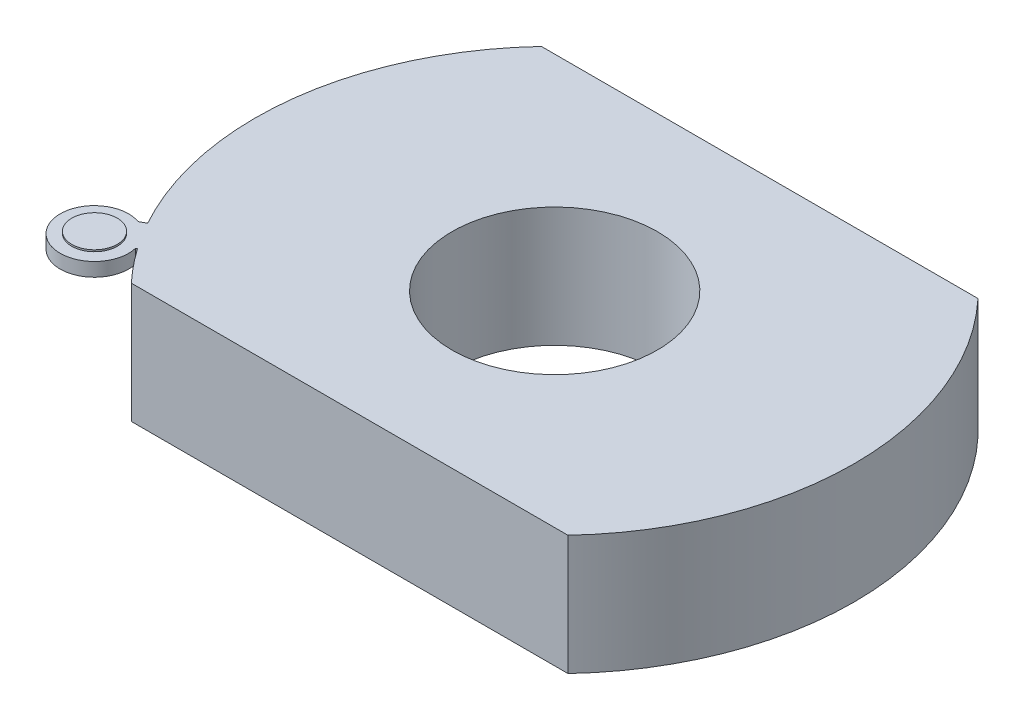
from build123d import *

# Parameters (mm, degrees)
SKETCH1_R                = 1750
BOSS_EXTRUDE1_DEPTH      = 700
CUT_EXTRUDE10_DEPTH      = 2572.964229922
CUT_EXTRUDE10_DEPTH_BACK = 2572.964229922
SKETCH9_W                = 5273.235769222
SKETCH9_H                = 4165.824449254
SKETCH9_W_2              = 4212.623718326
SKETCH9_H_2              = 2396.11984
CUT_EXTRUDE3_DEPTH       = 2234.348958831
CUT_EXTRUDE3_DEPTH_BACK  = 2234.348958831
SKETCH3_R                = 600
SHELL1_T                 = -1.5
BOSS_EXTRUDE2_START      = -80
BOSS_EXTRUDE2_DEPTH      = 80
SKETCH14_R               = 132.8125
BOSS_EXTRUDE5_DEPTH      = 10
SKETCH18_W               = 200
SKETCH18_H               = 200
SKETCH18_R               = 27.5
BOSS_EXTRUDE6_DEPTH      = 50


with BuildPart() as part:
    # Sketch1 → Boss-Extrude1 (new body)
    with BuildSketch(Plane(origin=(0, 0, 0), x_dir=(1, 0, 0), z_dir=(0, 1, 0))):
        Circle(SKETCH1_R)
    extrude(amount=BOSS_EXTRUDE1_DEPTH)

    # Sketch9 → Cut-Extrude10 (cut, two sides: drawn at the far end of the back side and taken through both)
    with BuildSketch(Plane.XZ.offset(-CUT_EXTRUDE10_DEPTH_BACK)):
        Rectangle(SKETCH9_W, SKETCH9_H)
        Rectangle(SKETCH9_W_2, SKETCH9_H_2, mode=Mode.SUBTRACT)
    extrude(amount=CUT_EXTRUDE10_DEPTH + CUT_EXTRUDE10_DEPTH_BACK, mode=Mode.SUBTRACT)

    # Sketch3 → Cut-Extrude3 (cut, two sides: drawn at the far end of the back side and taken through both)
    with BuildSketch(Plane.XZ.offset(-CUT_EXTRUDE3_DEPTH_BACK)):
        Circle(SKETCH3_R)
    extrude(amount=CUT_EXTRUDE3_DEPTH + CUT_EXTRUDE3_DEPTH_BACK, mode=Mode.SUBTRACT)

    # Shell1
    shell1_openings = [part.faces().sort_by_distance(p)[0] for p in [
        (1707.583740986, 0, 0),
    ]]
    offset(amount=SHELL1_T, openings=shell1_openings, kind=Kind.INTERSECTION)

    # Sketch12 → Boss-Extrude2 (add)
    with BuildSketch(Plane(origin=(0, 700, 0), x_dir=(1, 0, 0), z_dir=(0, 1, 0)).offset(BOSS_EXTRUDE2_START)):
        with BuildLine():
            Line((-1439.594389916, -1011.04969651), (-1432.096158714, -1005.78357125))
            ThreePointArc((-1432.096158714, -1005.78357125), (-1483.854285491, -927.726500338), (-1531.362261127, -847.012175352))
            Line((-1531.362261127, -847.012175352), (-1567.053683568, -866.753467227))
            ThreePointArc((-1567.053683568, -866.753467227), (-1784.610239672, -1187.36643031), (-1439.594389916, -1011.04969651))
        make_face()
    extrude(amount=BOSS_EXTRUDE2_DEPTH)

    # Sketch14 → Boss-Extrude5 (add)
    with BuildSketch(Plane(origin=(0, 700, 0), x_dir=(1, 0, 0), z_dir=(0, 1, 0))):
        with Locations((-1636.059482609, -1052.830646003)):
            Circle(SKETCH14_R)
    extrude(amount=BOSS_EXTRUDE5_DEPTH)

    # Sketch18 → Boss-Extrude6 (add)
    with BuildSketch(Plane.XZ.offset(-698.5)):
        with Locations((-1178.70980988, 0)):
            Rectangle(SKETCH18_W, SKETCH18_H)
        with Locations((-1178.70980988, 0)):
            Circle(SKETCH18_R, mode=Mode.SUBTRACT)
    extrude(amount=BOSS_EXTRUDE6_DEPTH)


solid = part.part
